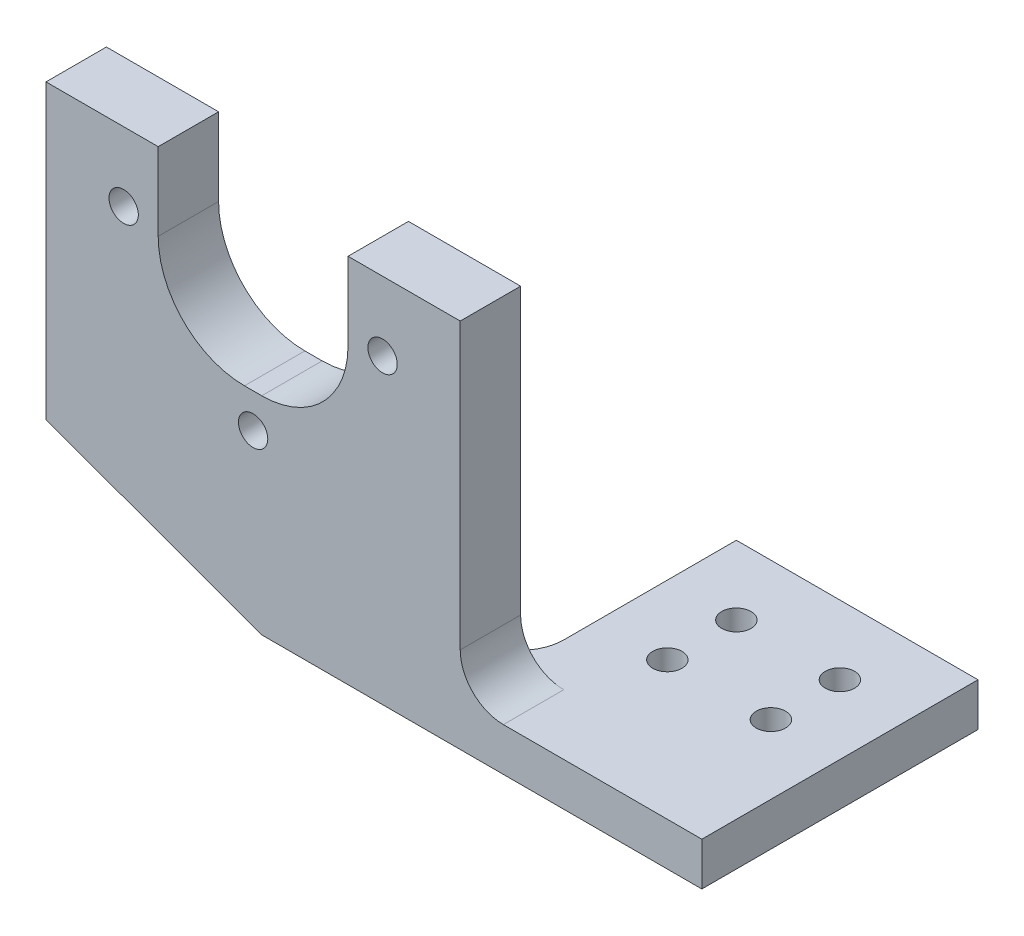
from build123d import *

# Parameters (mm, degrees)
SKETCH1_W            = 28
SKETCH1_H            = 32
BOSS_EXTRUDE1_DEPTH  = 5
M3_CLEARANCE_HOLE1_D = 3.4
BOSS_EXTRUDE2_DEPTH  = 7
FILLET1_R            = 10
FILLET2_R            = 5
FILLET3_R            = 5
M3_CLEARANCE_HOLE2_D = 3.4
CHAMFER1_SIZE        = 25
CHAMFER1_SIZE2       = 9.099255857


with BuildPart() as part:
    # Sketch1 → Boss-Extrude1 (new body)
    with BuildSketch(Plane(origin=(0, 0, 0), x_dir=(1, 0, 0), z_dir=(0, 1, 0))):
        Rectangle(SKETCH1_W, SKETCH1_H)
    extrude(amount=BOSS_EXTRUDE1_DEPTH)

    # M3 Clearance Hole1 (through all)
    with Locations(Plane(origin=(0, 5, 0), x_dir=(1, 0, 0), z_dir=(0, 1, 0))):
        with Locations((-6, 8), (6, 8), (6, 0), (-6, 0)):
            Hole(M3_CLEARANCE_HOLE1_D / 2)

    # Sketch5 → Boss-Extrude2 (add)
    with BuildSketch(Plane.XY.offset(16)):
        Polygon((-14, 0), (-62, 0), (-62, 43), (-49, 43), (-49, 24), (-27, 24), (-27, 43), (-14, 43), align=None)
    extrude(amount=-BOSS_EXTRUDE2_DEPTH)

    # Fillet1
    fillet1_edges = [part.edges().sort_by_distance(p)[0] for p in [
        (-27, 24, 12.5),
        (-49, 24, 12.5),
    ]]
    fillet(fillet1_edges, radius=FILLET1_R)

    # Fillet2
    fillet2_edges = [part.edges().sort_by_distance(p)[0] for p in [
        (-14, 5, 12.5),
    ]]
    fillet(fillet2_edges, radius=FILLET2_R)

    # Fillet3
    fillet3_edges = [part.edges().sort_by_distance(p)[0] for p in [
        (-14, 2.5, 9),
    ]]
    fillet(fillet3_edges, radius=FILLET3_R)

    # M3 Clearance Hole2 (through all)
    with Locations(Plane.XY.offset(16)):
        with Locations((-53, 35), (-23, 35), (-38, 20)):
            Hole(M3_CLEARANCE_HOLE2_D / 2)

    # Chamfer1
    chamfer1_edges = [part.edges().sort_by_distance(p)[0] for p in [
        (-62, 0, 12.5),
    ]]
    chamfer1_side = [part.faces().sort_by_distance(p)[0] for p in [
        (-10.698240226, 0, 3.653109537),
    ]]
    chamfer(chamfer1_edges, length=CHAMFER1_SIZE, length2=CHAMFER1_SIZE2, reference=chamfer1_side[0])


solid = part.part
